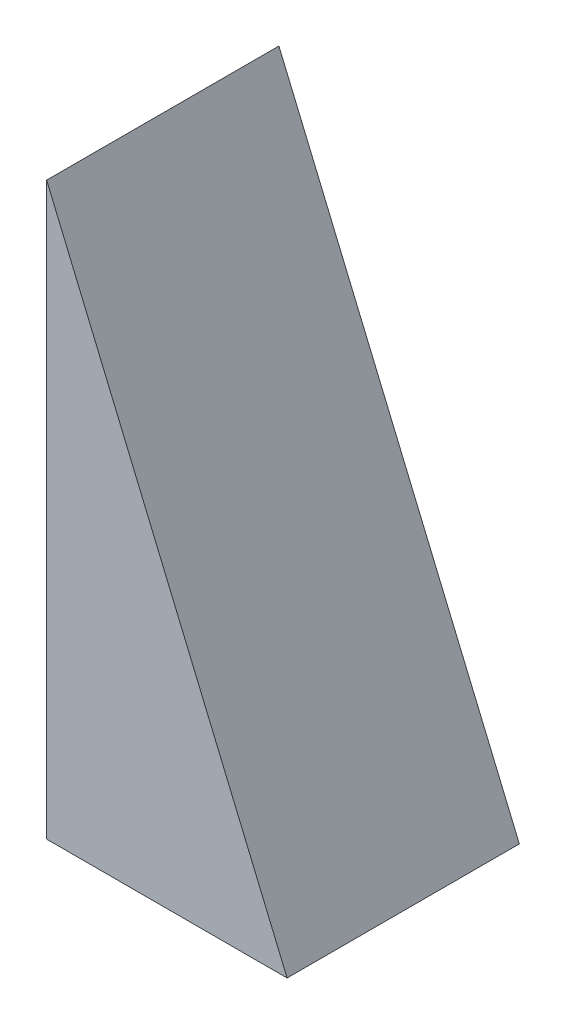
from build123d import *

# Parameters (mm, degrees)
BOSS_EXTRUDE1_DEPTH = 9.525


with BuildPart() as part:
    # Sketch1 → Boss-Extrude1 (new body)
    with BuildSketch(Plane.XY):
        Polygon((0, 0), (0, 23.407978516), (9.860352012, 0), align=None)
    extrude(amount=BOSS_EXTRUDE1_DEPTH)


solid = part.part
